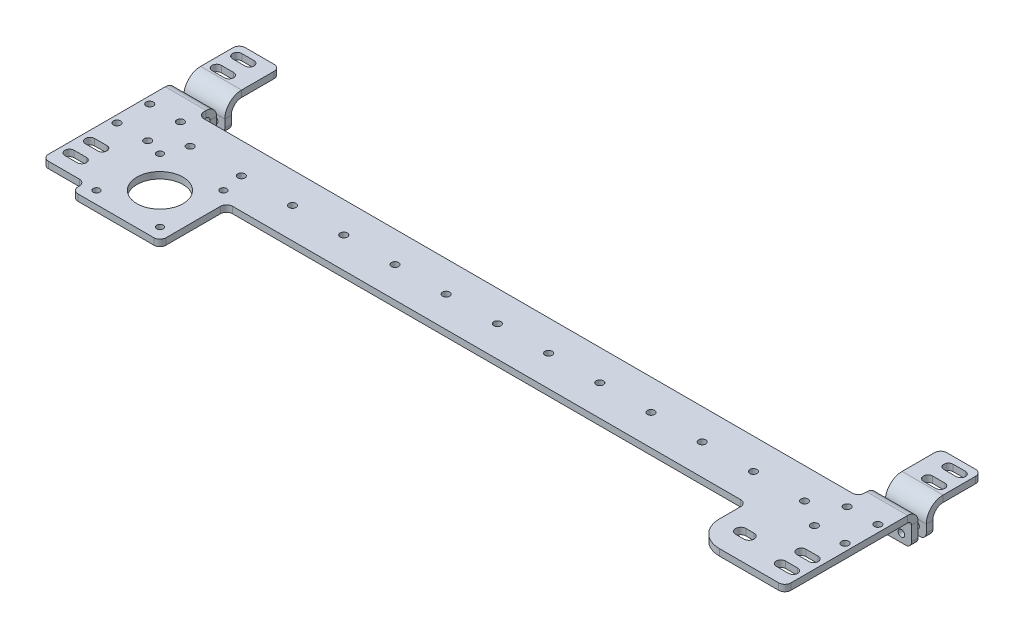
from build123d import *

# Parameters (mm, degrees)
SKETCH1_W                    = 362.5
SKETCH1_H                    = 30
SKETCH1_R                    = 1.75
BOSS_EXTRUDE1_DEPTH          = 3.175
SKETCH2_R                    = 1.6
BOSS_EXTRUDE2_DEPTH          = 3.175
SKETCH2_3_R                  = 1.6
CUT_EXTRUDE1_DEPTH           = 3.175
SKETCH14_W                   = 20
SKETCH14_H                   = 3.175
BOSS_EXTRUDE4_DEPTH          = 6
FILLET1_R                    = 3
EDGE_FLANGE1_START           = -181.25
EDGE_FLANGE1_DEPTH           = 362.5
EDGE_FLANGE1_START_2         = -161.25
EDGE_FLANGE1_2_DEPTH         = 322.5
EDGE_FLANGE1_3_DEPTH         = 20
EDGE_FLANGE1_START_3         = 161.25
EDGE_FLANGE1_4_DEPTH         = 20
FILLET2_R                    = 3
BASE_FLANGE1_START           = 3.175
BASE_FLANGE1_DEPTH           = 3.175
EDGE_FLANGE2_STRIP_W         = 22.7
EDGE_FLANGE2_STRIP_H         = 3.175
EDGE_FLANGE2_STRIP_CUT_DEPTH = 20
EDGE_FLANGE2_DEPTH           = 20
CUT_EXTRUDE2_DEPTH           = 3.175
FILLET3_R                    = 3
SKETCH41_R                   = 1.6
CUT_EXTRUDE3_DEPTH           = 199.011907786


# Read off the part's stored shape, not the designer's step: Edge-Flange1
# Sheet-metal steps are written as plain solids
with BuildPart() as part:
    # Sketch1 → Boss-Extrude1 (new body)
    with BuildSketch(Plane(origin=(0, 0, 0), x_dir=(1, 0, 0), z_dir=(0, 1, 0))):
        Rectangle(SKETCH1_W, SKETCH1_H)
        with Locations(Location((-177.75, 8, 0), (0, 0, 270))):
            Circle(SKETCH1_R, mode=Mode.SUBTRACT)
        with Locations(Location((-162.75, 8, 0), (0, 0, 270))):
            Circle(SKETCH1_R, mode=Mode.SUBTRACT)
        with Locations(Location((-177.75, -8, 0), (0, 0, 270))):
            Circle(SKETCH1_R, mode=Mode.SUBTRACT)
        with Locations(Location((-162.75, -8, 0), (0, 0, 270))):
            Circle(SKETCH1_R, mode=Mode.SUBTRACT)
        with Locations(Location((-150, 0, 0), (0, 0, 270))):
            Circle(SKETCH1_R, mode=Mode.SUBTRACT)
        with Locations(Location((-125, 0, 0), (0, 0, 270))):
            Circle(SKETCH1_R, mode=Mode.SUBTRACT)
        with Locations(Location((-100, 0, 0), (0, 0, 270))):
            Circle(SKETCH1_R, mode=Mode.SUBTRACT)
        with Locations(Location((-75, 0, 0), (0, 0, 270))):
            Circle(SKETCH1_R, mode=Mode.SUBTRACT)
        with Locations(Location((-50, 0, 0), (0, 0, 270))):
            Circle(SKETCH1_R, mode=Mode.SUBTRACT)
        with Locations(Location((-25, 0, 0), (0, 0, 270))):
            Circle(SKETCH1_R, mode=Mode.SUBTRACT)
        with Locations(Location((0, 0, 0), (0, 0, 270))):
            Circle(SKETCH1_R, mode=Mode.SUBTRACT)
        with Locations(Location((25, 0, 0), (0, 0, 270))):
            Circle(SKETCH1_R, mode=Mode.SUBTRACT)
        with Locations(Location((50, 0, 0), (0, 0, 270))):
            Circle(SKETCH1_R, mode=Mode.SUBTRACT)
        with Locations(Location((75, 0, 0), (0, 0, 270))):
            Circle(SKETCH1_R, mode=Mode.SUBTRACT)
        with Locations(Location((100, 0, 0), (0, 0, 270))):
            Circle(SKETCH1_R, mode=Mode.SUBTRACT)
        with Locations(Location((125, 0, 0), (0, 0, 270))):
            Circle(SKETCH1_R, mode=Mode.SUBTRACT)
        with Locations(Location((162.75, -8, 0), (0, 0, 90))):
            Circle(SKETCH1_R, mode=Mode.SUBTRACT)
        with Locations(Location((162.75, 8, 0), (0, 0, 90))):
            Circle(SKETCH1_R, mode=Mode.SUBTRACT)
        with Locations(Location((177.75, -8, 0), (0, 0, 90))):
            Circle(SKETCH1_R, mode=Mode.SUBTRACT)
        with Locations(Location((177.75, 8, 0), (0, 0, 90))):
            Circle(SKETCH1_R, mode=Mode.SUBTRACT)
        with Locations(Location((150, 0, 0), (0, 0, 270))):
            Circle(SKETCH1_R, mode=Mode.SUBTRACT)
    extrude(amount=BOSS_EXTRUDE1_DEPTH)

    # Sketch2 → Boss-Extrude2 (add)
    # profile 1 of 2: a face of its own
    with BuildSketch(Plane(origin=(0, 3.175, 0), x_dir=(1, 0, 0), z_dir=(0, 1, 0))):
        with BuildLine():
            Line((-181.25, -40.9), (-160.25, -40.9))
            Line((-160.25, -40.9), (-160.25, -47.5))
            Line((-160.25, -47.5), (-117.25, -47.5))
            Line((-117.25, -47.5), (-117.25, -15))
            Line((-117.25, -15), (-136.391504717, -15))
            ThreePointArc((-136.391504717, -15), (-130.000840842, -18.927891825), (-127.5, -26))
            ThreePointArc((-127.5, -26), (-145.822108175, -34.749159158), (-141.108495283, -15))
            Line((-141.108495283, -15), (-181.25, -15))
            Line((-181.25, -15), (-181.25, -40.9))
        make_face()
        with Locations(Location((-154.25, -41.5, 0), (0, 0, 270))):
            Circle(SKETCH2_R, mode=Mode.SUBTRACT)
        with Locations(Location((-123.25, -41.5, 0), (0, 0, 270))):
            Circle(SKETCH2_R, mode=Mode.SUBTRACT)
        with BuildLine():
            Line((-170.65, -34.5), (-176.65, -34.5))
            ThreePointArc((-176.65, -34.5), (-178.9, -32.25), (-176.65, -30))
            Line((-176.65, -30), (-170.65, -30))
            ThreePointArc((-170.65, -30), (-168.4, -32.25), (-170.65, -34.5))
        make_face(mode=Mode.SUBTRACT)
        with BuildLine():
            Line((-170.65, -24.5), (-176.65, -24.5))
            ThreePointArc((-176.65, -24.5), (-178.9, -22.25), (-176.65, -20))
            Line((-176.65, -20), (-170.65, -20))
            ThreePointArc((-170.65, -20), (-168.4, -22.25), (-170.65, -24.5))
        make_face(mode=Mode.SUBTRACT)
    # profile 2 of 2: a face of its own
    with BuildSketch(Plane(origin=(0, 3.175, 0), x_dir=(1, 0, 0), z_dir=(0, 1, 0))):
        with BuildLine():
            Line((181.25, -15), (136.75, -15))
            Line((136.75, -15), (136.75, -28.4))
            ThreePointArc((136.75, -28.4), (140.411165235, -37.238834765), (149.25, -40.9))
            Line((149.25, -40.9), (181.25, -40.9))
            Line((181.25, -40.9), (181.25, -15))
        make_face()
        with BuildLine():
            ThreePointArc((176.65, -30), (178.9, -32.25), (176.65, -34.5))
            Line((176.65, -34.5), (170.65, -34.5))
            ThreePointArc((170.65, -34.5), (168.4, -32.25), (170.65, -30))
            Line((170.65, -30), (176.65, -30))
        make_face(mode=Mode.SUBTRACT)
        with BuildLine():
            ThreePointArc((147.25, -30.9), (144.75, -28.4), (147.25, -25.9))
            Line((147.25, -25.9), (151.25, -25.9))
            ThreePointArc((151.25, -25.9), (153.75, -28.4), (151.25, -30.9))
            Line((151.25, -30.9), (147.25, -30.9))
        make_face(mode=Mode.SUBTRACT)
        with BuildLine():
            ThreePointArc((176.65, -20), (178.9, -22.25), (176.65, -24.5))
            Line((176.65, -24.5), (170.65, -24.5))
            ThreePointArc((170.65, -24.5), (168.4, -22.25), (170.65, -20))
            Line((170.65, -20), (176.65, -20))
        make_face(mode=Mode.SUBTRACT)
    extrude(amount=-BOSS_EXTRUDE2_DEPTH)

    # Sketch2<3> → Cut-Extrude1 (cut)
    with BuildSketch(Plane(origin=(0, 3.175, 0), x_dir=(1, 0, 0), z_dir=(0, 1, 0))):
        with Locations(Location((-154.25, -10.5, 0), (0, 0, 270))):
            Circle(SKETCH2_3_R)
        with Locations(Location((-123.25, -10.5, 0), (0, 0, 270))):
            Circle(SKETCH2_3_R)
        with BuildLine():
            ThreePointArc((-136.391504717, -15), (-138.75, -14.75), (-141.108495283, -15))
            Line((-141.108495283, -15), (-136.391504717, -15))
        make_face()
        with BuildLine():
            Line((-136.391504717, -15), (-141.108495283, -15))
            ThreePointArc((-141.108495283, -15), (-145.822108175, -34.749159158), (-127.5, -26))
            ThreePointArc((-127.5, -26), (-130.000840842, -18.927891825), (-136.391504717, -15))
        make_face()
    extrude(amount=-CUT_EXTRUDE1_DEPTH, mode=Mode.SUBTRACT)

    # Sketch14 → Boss-Extrude4 (add)
    with BuildSketch(Plane(origin=(0, 0, -15), x_dir=(-1, 0, 0), z_dir=(0, 0, -1))):
        with Locations((-171.25, 1.5875)):
            Rectangle(SKETCH14_W, SKETCH14_H)
        with Locations((171.25, 1.5875)):
            Rectangle(SKETCH14_W, SKETCH14_H)
    extrude(amount=BOSS_EXTRUDE4_DEPTH)

    # Fillet1
    fillet1_edges = [part.edges().sort_by_distance(p)[0] for p in [
        (-117.25, 1.5875, 15),
        (-117.25, 1.5875, 47.5),
        (-160.25, 1.5875, 47.5),
        (-160.25, 1.5875, 40.9),
        (-181.25, 1.5875, 40.9),
        (136.75, 1.5875, 15),
        (181.25, 1.5875, 40.9),
        (161.25, 1.5875, -15),
        (-161.25, 1.5875, -15),
    ]]
    fillet(fillet1_edges, radius=FILLET1_R)

    # Edge-Flange1 outline → Edge-Flange1 (cut)
    with BuildSketch(Plane.YZ.offset(EDGE_FLANGE1_START)):
        with BuildLine():
            Line((3.175, -21), (3.175, -19.095))
            ThreePointArc((3.175, -19.095), (3.081460321, -20.065367693), (2.804286039, -21))
            Line((2.804286039, -21), (3.175, -21))
        make_face()
    extrude(amount=EDGE_FLANGE1_DEPTH, mode=Mode.SUBTRACT)

    # Edge-Flange1 2 outline → Edge-Flange1 2 (cut)
    with BuildSketch(Plane.YZ.offset(EDGE_FLANGE1_START_2)):
        with BuildLine():
            Line((3.175, -17.5075), (0, -17.5075))
            Line((0, -17.5075), (0, -21))
            Line((0, -21), (2.804286039, -21))
            ThreePointArc((2.804286039, -21), (3.081460321, -20.065367693), (3.175, -19.095))
            Line((3.175, -19.095), (3.175, -17.5075))
        make_face()
    extrude(amount=EDGE_FLANGE1_2_DEPTH, mode=Mode.SUBTRACT)

    # Edge-Flange1 3 outline → Edge-Flange1 3 (add)
    with BuildSketch(Plane.YZ.offset(EDGE_FLANGE1_START)):
        with BuildLine():
            Line((0, -21), (0, -19.095))
            ThreePointArc((0, -19.095), (-0.557961582, -20.442038418), (-1.905, -21))
            Line((-1.905, -21), (-11.825, -21))
            Line((-11.825, -21), (-11.825, -24.175))
            Line((-11.825, -24.175), (-1.905, -24.175))
            ThreePointArc((-1.905, -24.175), (0.934806331, -23.307113483), (2.804286039, -21))
            Line((2.804286039, -21), (0, -21))
        make_face()
    extrude(amount=EDGE_FLANGE1_3_DEPTH)

    # Edge-Flange1 4 outline → Edge-Flange1 4 (add)
    with BuildSketch(Plane.YZ.offset(EDGE_FLANGE1_START_3)):
        with BuildLine():
            Line((0, -21), (0, -19.095))
            ThreePointArc((0, -19.095), (-0.557961582, -20.442038418), (-1.905, -21))
            Line((-1.905, -21), (-11.825, -21))
            Line((-11.825, -21), (-11.825, -24.175))
            Line((-11.825, -24.175), (-1.905, -24.175))
            ThreePointArc((-1.905, -24.175), (0.934806331, -23.307113483), (2.804286039, -21))
            Line((2.804286039, -21), (0, -21))
        make_face()
    extrude(amount=EDGE_FLANGE1_4_DEPTH)

    # Fillet2
    fillet2_edges = [part.edges().sort_by_distance(p)[0] for p in [
        (161.25, -11.825, -22.5875),
        (181.25, -11.825, -22.5875),
        (-181.25, -11.825, -22.5875),
        (-161.25, -11.825, -22.5875),
    ]]
    fillet(fillet2_edges, radius=FILLET2_R)


with BuildPart() as body_2:
    # Sketch31 → Base-Flange1 (new body)
    with BuildSketch(Plane(origin=(0, 0, -28.175), x_dir=(-1, 0, 0), z_dir=(0, 0, -1)).offset(BASE_FLANGE1_START)):
        with BuildLine():
            Line((-181.25, 3.175), (-161.25, 3.175))
            Line((-161.25, 3.175), (-161.25, -8.825))
            ThreePointArc((-161.25, -8.825), (-162.128679656, -10.946320344), (-164.25, -11.825))
            Line((-164.25, -11.825), (-178.25, -11.825))
            ThreePointArc((-178.25, -11.825), (-180.371320344, -10.946320344), (-181.25, -8.825))
            Line((-181.25, -8.825), (-181.25, 3.175))
        make_face()
    extrude(amount=-BASE_FLANGE1_DEPTH)

    # Edge-Flange2 strip (across the edge) → Edge-Flange2 strip cut (cut)
    with BuildSketch(Plane(origin=(161.25, 3.175, -31.35), x_dir=(0, -1, 0), z_dir=(1, 0, 0))):
        with Locations((-3.175, -1.5875)):
            Rectangle(EDGE_FLANGE2_STRIP_W, EDGE_FLANGE2_STRIP_H)
    extrude(amount=EDGE_FLANGE2_STRIP_CUT_DEPTH, mode=Mode.SUBTRACT)

    # Edge-Flange2 section (across the edge) → Edge-Flange2 (add)
    with BuildSketch(Plane(origin=(161.25, 3.175, -31.35), x_dir=(0, -1, 0), z_dir=(1, 0, 0))):
        with BuildLine():
            Line((0, 5), (0, 23.825))
            Line((0, 23.825), (3.175, 23.825))
            Line((3.175, 23.825), (3.175, 5))
            ThreePointArc((3.175, 5), (4.639466094, 1.464466094), (8.175, 0))
            Line((8.175, 0), (8.175, -3.175))
            ThreePointArc((8.175, -3.175), (2.394402064, -0.780597936), (0, 5))
        make_face()
    extrude(amount=EDGE_FLANGE2_DEPTH)

    # Sketch37 → Cut-Extrude2 (cut)
    with BuildSketch(Plane(origin=(0, 3.175, 0), x_dir=(1, 0, 0), z_dir=(0, 1, 0))):
        with BuildLine():
            Line((176.65, 37.35), (170.65, 37.35))
            ThreePointArc((170.65, 37.35), (168.4, 39.6), (170.65, 41.85))
            Line((170.65, 41.85), (176.65, 41.85))
            ThreePointArc((176.65, 41.85), (178.9, 39.6), (176.65, 37.35))
        make_face()
        with BuildLine():
            Line((176.65, 47.35), (170.65, 47.35))
            ThreePointArc((170.65, 47.35), (168.4, 49.6), (170.65, 51.85))
            Line((170.65, 51.85), (176.65, 51.85))
            ThreePointArc((176.65, 51.85), (178.9, 49.6), (176.65, 47.35))
        make_face()
    extrude(amount=-CUT_EXTRUDE2_DEPTH, mode=Mode.SUBTRACT)

    # Fillet3
    fillet3_edges = [body_2.edges().sort_by_distance(p)[0] for p in [
        (161.25, 1.5875, -55.175),
        (181.25, 1.5875, -55.175),
    ]]
    fillet(fillet3_edges, radius=FILLET3_R)


with BuildPart() as body_3:
    # Mirror2: mirrored copy
    add(body_2.part.mirror(Plane(origin=(0, 0, 0), x_dir=(0, 0, 1), z_dir=(1, 0, 0))))


with BuildPart() as cut_extrude3_tool:
    # Sketch41 → Cut-Extrude3 (new, through all)
    with BuildSketch(Plane(origin=(0, 0, -31.35), x_dir=(-1, 0, 0), z_dir=(0, 0, -1))):
        with Locations(Location((-176.25, -7.825, 0), (0, 0, 90))):
            Circle(SKETCH41_R)
        with Locations(Location((-166.25, -7.825, 0), (0, 0, 90))):
            Circle(SKETCH41_R)
    cut_extrude3 = extrude(amount=-CUT_EXTRUDE3_DEPTH)


with BuildPart() as part_1:
    add(part.part)

    # Cut-Extrude3: cut by cut_extrude3_tool
    add(cut_extrude3_tool.part, mode=Mode.SUBTRACT)


with BuildPart() as body_2_1:
    add(body_2.part)

    # Cut-Extrude3: cut by cut_extrude3_tool
    add(cut_extrude3_tool.part, mode=Mode.SUBTRACT)


with BuildPart() as mirror3_tool:
    # Mirror3: Cut-Extrude3 across plane
    add(cut_extrude3.mirror(Plane(origin=(0, 0, 0), x_dir=(0, 0, 1), z_dir=(1, 0, 0))))


with BuildPart() as part_2:
    add(part_1.part)

    # Mirror3: cut by mirror3_tool
    add(mirror3_tool.part, mode=Mode.SUBTRACT)


with BuildPart() as body_3_1:
    add(body_3.part)

    # Mirror3: cut by mirror3_tool
    add(mirror3_tool.part, mode=Mode.SUBTRACT)


solid = Compound([body_2_1.part, part_2.part, body_3_1.part])
